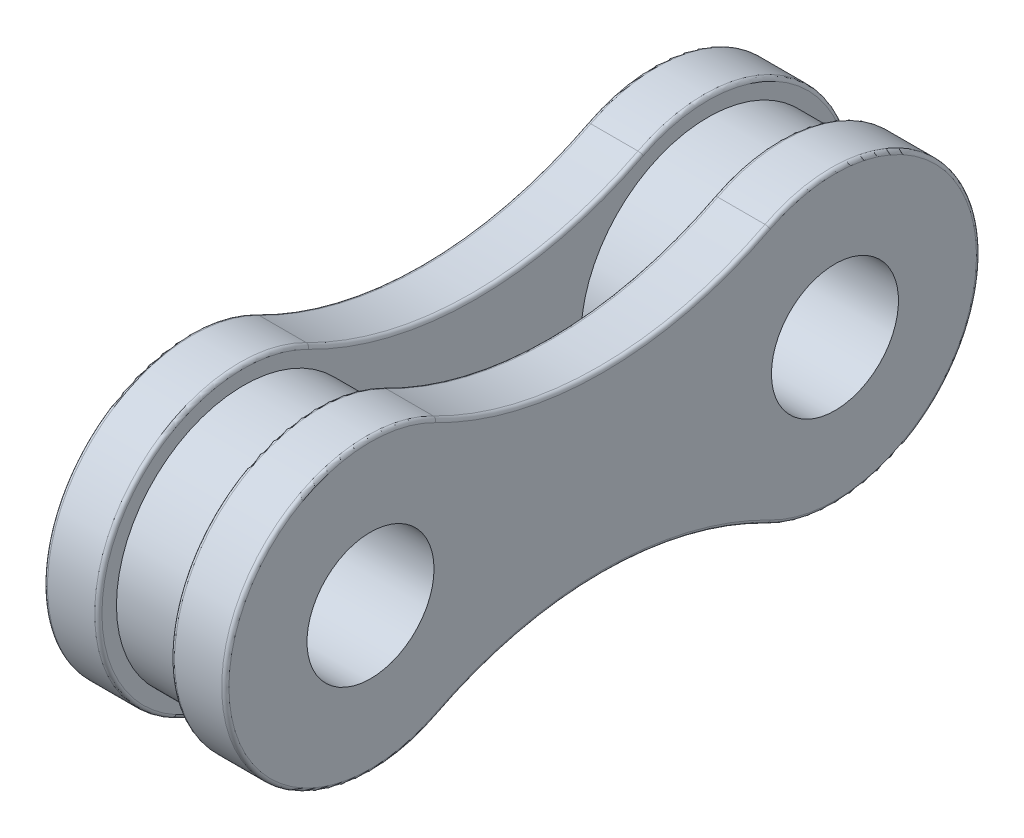
from build123d import *

# Parameters (mm, degrees)
BOSS_EXTRUDE1_START = 1
SKETCH1_R           = 1.75
BOSS_EXTRUDE1_DEPTH = 1.5
BOSS_EXTRUDE2_START = -1
SKETCH2_R           = 1.75
BOSS_EXTRUDE2_DEPTH = 1.5
SKETCH3_R           = 3.5
SKETCH3_R_2         = 1.75
BOSS_EXTRUDE3_DEPTH = 1
FILLET1_R           = 0.1


with BuildPart() as part:
    # Sketch1 → Boss-Extrude1 (new body)
    with BuildSketch(Plane(origin=(0, 0, 0), x_dir=(0, 0, -1), z_dir=(1, 0, 0)).offset(BOSS_EXTRUDE1_START)):
        with BuildLine():
            ThreePointArc((-4.570357143, 3.557793374), (-10.3985, 0), (-4.570357143, -3.557793374))
            ThreePointArc((-4.570357143, -3.557793374), (0, -2.45227681), (4.570357143, -3.557793374))
            ThreePointArc((4.570357143, -3.557793374), (10.3985, 0), (4.570357143, 3.557793374))
            ThreePointArc((4.570357143, 3.557793374), (0, 2.45227681), (-4.570357143, 3.557793374))
        make_face()
        with Locations((-6.3985, 0)):
            Circle(SKETCH1_R, mode=Mode.SUBTRACT)
        with Locations((6.3985, 0)):
            Circle(SKETCH1_R, mode=Mode.SUBTRACT)
    extrude(amount=BOSS_EXTRUDE1_DEPTH)



with BuildPart() as body_2:
    # Sketch2 → Boss-Extrude2 (new body)
    with BuildSketch(Plane(origin=(0, 0, 0), x_dir=(0, 0, -1), z_dir=(1, 0, 0)).offset(BOSS_EXTRUDE2_START)):
        with BuildLine():
            ThreePointArc((4.570357143, -3.557793374), (0, -2.45227681), (-4.570357143, -3.557793374))
            ThreePointArc((-4.570357143, -3.557793374), (-10.3985, 0), (-4.570357143, 3.557793374))
            ThreePointArc((-4.570357143, 3.557793374), (0, 2.45227681), (4.570357143, 3.557793374))
            ThreePointArc((4.570357143, 3.557793374), (10.3985, 0), (4.570357143, -3.557793374))
        make_face()
        with Locations((-6.3985, 0)):
            Circle(SKETCH2_R, mode=Mode.SUBTRACT)
        with Locations((6.3985, 0)):
            Circle(SKETCH2_R, mode=Mode.SUBTRACT)
    extrude(amount=-BOSS_EXTRUDE2_DEPTH)


with BuildPart() as part_1:
    add(part.part)

    add(body_2.part)  # Boss-Extrude3 merges body 2
    # Sketch3 → Boss-Extrude3 (add, symmetric)
    # profile 1 of 2: a face of its own
    with BuildSketch(Plane(origin=(0, 0, 0), x_dir=(0, 0, -1), z_dir=(1, 0, 0))):
        with Locations((6.3985, 0)):
            Circle(SKETCH3_R)
        with Locations((6.3985, 0)):
            Circle(SKETCH3_R_2, mode=Mode.SUBTRACT)
    # profile 2 of 2: a face of its own
    with BuildSketch(Plane(origin=(0, 0, 0), x_dir=(0, 0, -1), z_dir=(1, 0, 0))):
        with Locations((-6.3985, 0)):
            Circle(SKETCH3_R)
        with Locations((-6.3985, 0)):
            Circle(SKETCH3_R_2, mode=Mode.SUBTRACT)
    extrude(amount=BOSS_EXTRUDE3_DEPTH, both=True)

    # Fillet1
    fillet1_edges = [part_1.edges().sort_by_distance(p)[0] for p in [
        (2.5, 0, 10.3985),
        (2.5, 2.45227681, 0),
        (2.5, 0, -10.3985),
        (1, 0, 10.3985),
        (1, 2.45227681, 0),
        (1, 0, -10.3985),
        (-1, 0, 10.3985),
        (-1, 2.45227681, 0),
        (-1, 0, -10.3985),
        (-2.5, 0, 10.3985),
        (-2.5, 2.45227681, 0),
        (-2.5, 0, -10.3985),
        (2.5, -2.45227681, 0),
        (1, -2.45227681, 0),
        (-1, -2.45227681, 0),
        (-2.5, -2.45227681, 0),
    ]]
    fillet(fillet1_edges, radius=FILLET1_R)


solid = part_1.part
